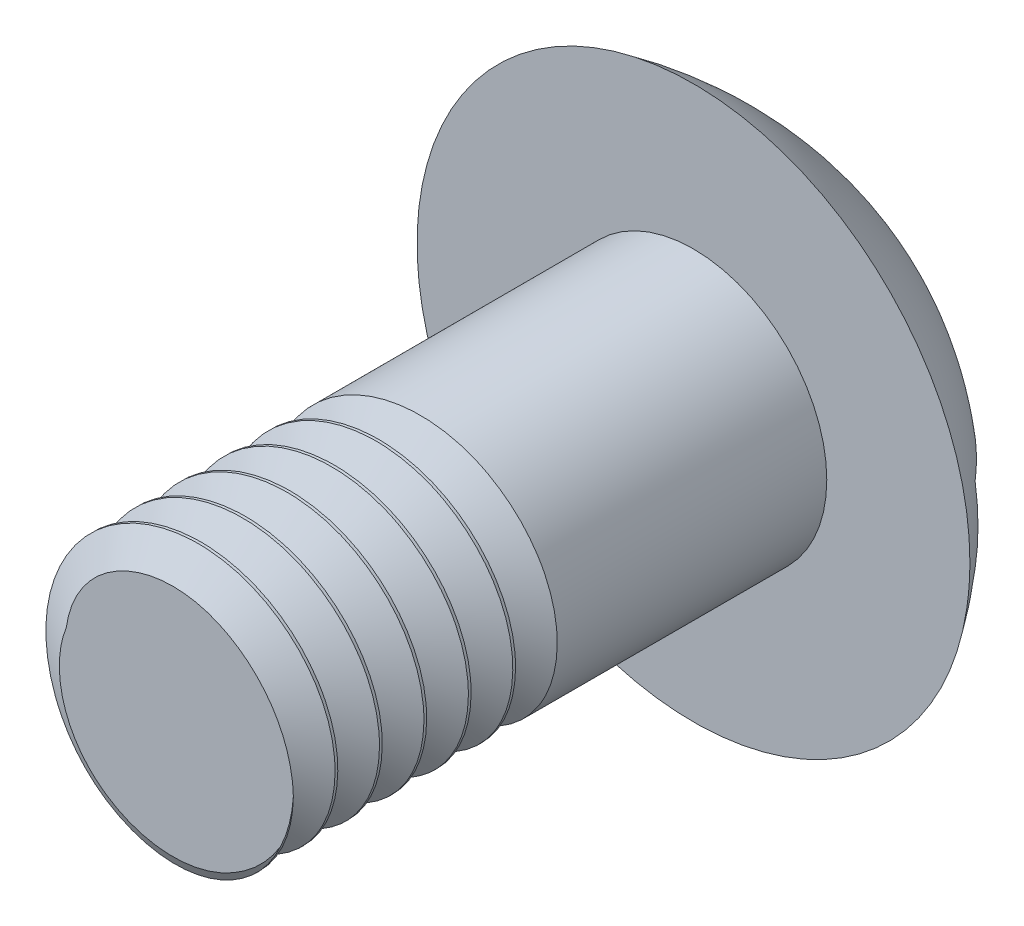
from build123d import *

# Parameters (mm, degrees)
SKETCH1_R           = 1.5
BOSS_EXTRUDE1_DEPTH = 6
CUT_SWEEP1_PITCH    = 0.5
SKETCH5_W           = 11.492043773
SKETCH5_H           = 0.85
CUT_EXTRUDE1_DEPTH  = 2


with BuildPart() as part:
    # Sketch1 → Boss-Extrude1 (new body)
    with BuildSketch(Plane.XY):
        Circle(SKETCH1_R)
    extrude(amount=BOSS_EXTRUDE1_DEPTH)

    # Cut-Sweep1: arcs per turn and ends read off the stored shape
    # Cut-Sweep1: the profile of Sketch3 screwed along a right-hand helix through 7 turns, 6 arcs to a turn; built about Z, then put on its axis
    cut_sweep1_z = Axis((0, 0, 0), (0, 0, 1))
    cut_sweep1_corners = [(1.094191853, 0.001044043, -0.519679739), (1.509884047, -0.011670473, -0.280016765), (1.509884047, 0.013758558, -0.759342713)]
    with BuildLine(mode=Mode.PRIVATE) as cut_sweep1_profile:
        Line(cut_sweep1_corners[0], cut_sweep1_corners[1])
        Line(cut_sweep1_corners[1], cut_sweep1_corners[2])
        Line(cut_sweep1_corners[2], cut_sweep1_corners[0])
    cut_sweep1_cap = Face(cut_sweep1_profile.wire())
    cut_sweep1_turn_angles = [0, 30, 60, 90, 120, 150, 180, 210, 240, 270, 300, 330, 360]
    cut_sweep1_turn_weights = [1, 0.8660254037844387, 1, 0.8660254037844387, 1, 0.8660254037844387, 1, 0.8660254037844387, 1, 0.8660254037844387, 1, 0.8660254037844387, 1]
    cut_sweep1_turn_rails = [Edge.make_bspline([Vector(p[0], p[1], 0).rotate(cut_sweep1_z, cut_sweep1_turn_angles[k]) / cut_sweep1_turn_weights[k] + Vector(0, 0, p[2] + CUT_SWEEP1_PITCH * cut_sweep1_turn_angles[k] / 360) for k in range(13)], [0, 0, 0, 1, 1, 2, 2, 3, 3, 4, 4, 5, 5, 6, 6, 6], 2, cut_sweep1_turn_weights) for p in cut_sweep1_corners]
    cut_sweep1_turn_sides = [Face.make_surface_from_curves(cut_sweep1_turn_rails[p[0]], cut_sweep1_turn_rails[p[1]]) for p in [(0, 1), (1, 2), (2, 0)]]
    cut_sweep1 = Plane(origin=(0, 0, 6), x_dir=(-1, 0, 0), z_dir=(0, 0, -1)) * Solid(Shell([*[p.moved(Location((0, 0, CUT_SWEEP1_PITCH * i))) for i in range(7) for p in cut_sweep1_turn_sides], cut_sweep1_cap, cut_sweep1_cap.rotate(cut_sweep1_z, 2520).moved(Location((0, 0, CUT_SWEEP1_PITCH * 2520 / 360)))]))
    add(cut_sweep1, mode=Mode.SUBTRACT)

    # Sketch4 → Revolve1 (revolve)
    with BuildSketch(Plane(origin=(0, 0, 0), x_dir=(0, 0, -1), z_dir=(1, 0, 0)), mode=Mode.PRIVATE) as revolve1_sk:
        with BuildLine():
            Line((0, -3.110484298), (0, 0))
            Line((0, 0), (1.827405733, 0))
            add(Edge.make_bspline(
                [(1.827405733, 0), (1.614806924, -1.993581121), (0, -3.110484298)],
                knots=[0, 0, 0, 1, 1, 1], degree=2))
        make_face()
    revolve(revolve1_sk.sketch.rotate(Axis((0, 0, 0), (0, 0, -1)), 89.565814591), axis=Axis((0, 0, 0), (0, 0, -1)))

    # Sketch5 → Cut-Extrude1 (cut)
    with BuildSketch(Plane.XY.offset(-0.396562646)):
        with Locations((0.364356631, 0)):
            Rectangle(SKETCH5_W, SKETCH5_H)
    extrude(amount=-CUT_EXTRUDE1_DEPTH, mode=Mode.SUBTRACT)


solid = part.part
